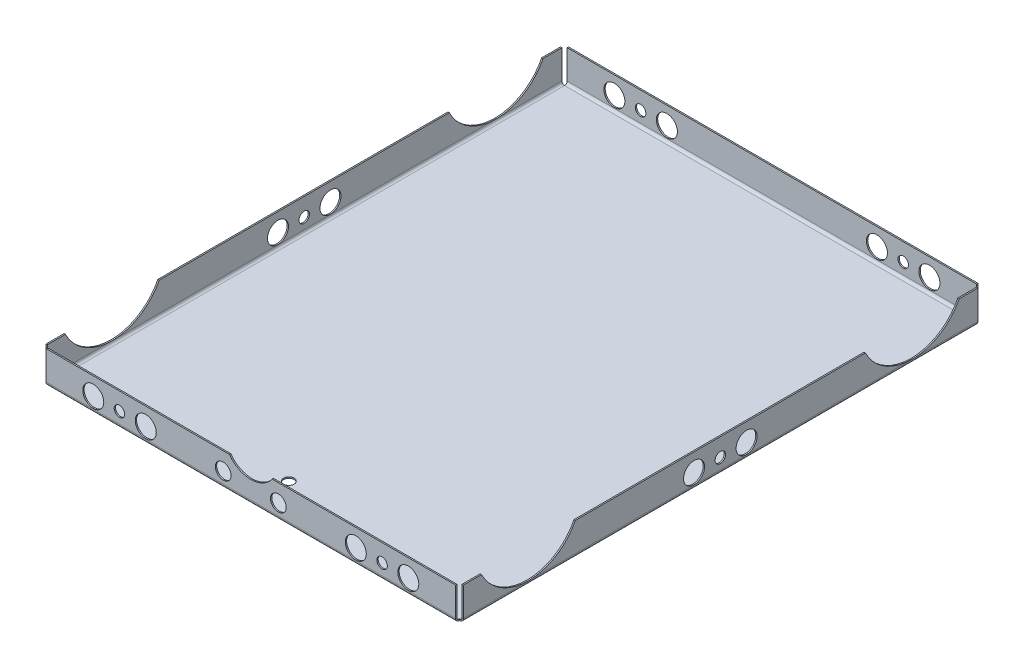
from build123d import *

# Parameters (mm, degrees)
SKETCH1_W           = 156
SKETCH1_H           = 196
BASE_FLANGE1_DEPTH  = 0.5
EDGE_FLANGE1_DEPTH  = 196
EDGE_FLANGE2_DEPTH  = 156
EDGE_FLANGE3_DEPTH  = 196
EDGE_FLANGE4_DEPTH  = 156
SKETCH14_R          = 3
CUT_EXTRUDE1_DEPTH  = 2
CUT_EXTRUDE2_START  = -0.5
CUT_EXTRUDE2_DEPTH  = 0.5
CUT_EXTRUDE7_START  = -0.5
CUT_EXTRUDE7_DEPTH  = 0.5
SKETCH18_R          = 2
CUT_EXTRUDE8_DEPTH  = 254.83311453
SKETCH19_R          = 2
CUT_EXTRUDE9_DEPTH  = 255.06938035
SKETCH20_R          = 4
CUT_EXTRUDE10_DEPTH = 5
CUT_EXTRUDE11_START = -5
SKETCH21_R          = 4
CUT_EXTRUDE11_DEPTH = 5
SKETCH22_R          = 4
CUT_EXTRUDE12_DEPTH = 5
CUT_EXTRUDE13_START = -5
SKETCH23_R          = 4
CUT_EXTRUDE13_DEPTH = 5
SKETCH24_R          = 10
CUT_EXTRUDE14_DEPTH = 1
SKETCH25_R          = 2
CUT_EXTRUDE15_DEPTH = 2


# Read off the part's stored shape, not the designer's step: Cut-Extrude2, Cut-Extrude7
# Sheet-metal steps are written as plain solids
with BuildPart() as part:
    # Sketch1 → Base-Flange1 (new body)
    with BuildSketch(Plane(origin=(0, 0, 0), x_dir=(1, 0, 0), z_dir=(0, 1, 0))):
        with Locations((78, -98)):
            Rectangle(SKETCH1_W, SKETCH1_H)
    extrude(amount=-BASE_FLANGE1_DEPTH)

    # Edge-Flange1 section (across the edge) → Edge-Flange1 (add)
    with BuildSketch(Plane(origin=(-1, 0, 0), x_dir=(1, 0, 0), z_dir=(0, 0, 1))):
        with BuildLine():
            Line((-0.5, 1), (-0.5, 12))
            Line((-0.5, 12), (0, 12))
            Line((0, 12), (0, 1))
            ThreePointArc((0, 1), (0.292893219, 0.292893219), (1, 0))
            Line((1, 0), (1, -0.5))
            ThreePointArc((1, -0.5), (-0.060660172, -0.060660172), (-0.5, 1))
        make_face()
    extrude(amount=EDGE_FLANGE1_DEPTH)

    # Edge-Flange2 section (across the edge) → Edge-Flange2 (add)
    with BuildSketch(Plane(origin=(0, 0, 197), x_dir=(0, 0, -1), z_dir=(1, 0, 0))):
        with BuildLine():
            Line((-0.5, 1), (-0.5, 12))
            Line((-0.5, 12), (0, 12))
            Line((0, 12), (0, 1))
            ThreePointArc((0, 1), (0.292893219, 0.292893219), (1, 0))
            Line((1, 0), (1, -0.5))
            ThreePointArc((1, -0.5), (-0.060660172, -0.060660172), (-0.5, 1))
        make_face()
    extrude(amount=EDGE_FLANGE2_DEPTH)

    # Edge-Flange3 section (across the edge) → Edge-Flange3 (add)
    with BuildSketch(Plane(origin=(157, 0, 196), x_dir=(-1, 0, 0), z_dir=(0, 0, -1))):
        with BuildLine():
            Line((-0.5, 1), (-0.5, 12))
            Line((-0.5, 12), (0, 12))
            Line((0, 12), (0, 1))
            ThreePointArc((0, 1), (0.292893219, 0.292893219), (1, 0))
            Line((1, 0), (1, -0.5))
            ThreePointArc((1, -0.5), (-0.060660172, -0.060660172), (-0.5, 1))
        make_face()
    extrude(amount=EDGE_FLANGE3_DEPTH)

    # Edge-Flange4 section (across the edge) → Edge-Flange4 (add)
    with BuildSketch(Plane(origin=(156, 0, -1), x_dir=(0, 0, 1), z_dir=(-1, 0, 0))):
        with BuildLine():
            Line((-0.5, 1), (-0.5, 12))
            Line((-0.5, 12), (0, 12))
            Line((0, 12), (0, 1))
            ThreePointArc((0, 1), (0.292893219, 0.292893219), (1, 0))
            Line((1, 0), (1, -0.5))
            ThreePointArc((1, -0.5), (-0.060660172, -0.060660172), (-0.5, 1))
        make_face()
    extrude(amount=EDGE_FLANGE4_DEPTH)

    # Sketch14 → Cut-Extrude1 (cut)
    with BuildSketch(Plane.XY.offset(197.5)):
        with Locations((88.5, 5.312571767)):
            Circle(SKETCH14_R)
        with Locations((67.5, 5.312571767)):
            Circle(SKETCH14_R)
    extrude(amount=-CUT_EXTRUDE1_DEPTH, mode=Mode.SUBTRACT)

    # Cut-Extrude2 outline → Cut-Extrude2 (cut)
    with BuildSketch(Plane.ZY.offset(1.5).offset(CUT_EXTRUDE2_START)):
        with BuildLine():
            ThreePointArc((7.181368129, 12), (14.44892966, 4.034634629), (24.795691895, 1))
            add(Edge.make_bspline(
                [(24.795691895, 1), (24.960369193, 1), (25.12504649, 1), (25.289723788, 1)],
                knots=[0, 0, 0, 0, 1, 1, 1, 1], degree=3))
            ThreePointArc((25.289723788, 1), (35.636486024, 4.034634629), (42.904047554, 12))
            Line((42.904047554, 12), (7.181368129, 12))
        make_face()
        with BuildLine():
            Line((189.110571099, 12), (153.389428901, 12))
            ThreePointArc((153.389428901, 12), (171.25, 1), (189.110571099, 12))
        make_face()
    extrude(amount=CUT_EXTRUDE2_DEPTH, mode=Mode.SUBTRACT)

    # Cut-Extrude7 outline → Cut-Extrude7 (cut)
    with BuildSketch(Plane(origin=(157.5, 0, 0), x_dir=(0, 0, -1), z_dir=(1, 0, 0)).offset(CUT_EXTRUDE7_START)):
        with BuildLine():
            ThreePointArc((-189.110571099, 12), (-171.25, 1), (-153.389428901, 12))
            Line((-153.389428901, 12), (-189.110571099, 12))
        make_face()
        with BuildLine():
            add(Edge.make_bspline(
                [(-24.795691895, 1), (-24.960369193, 1), (-25.12504649, 1), (-25.289723788, 1)],
                knots=[0, 0, 0, 0, 1, 1, 1, 1], degree=3))
            ThreePointArc((-24.795691895, 1), (-14.44892966, 4.034634629), (-7.181368129, 12))
            Line((-7.181368129, 12), (-42.904047554, 12))
            ThreePointArc((-42.904047554, 12), (-35.636486024, 4.034634629), (-25.289723788, 1))
        make_face()
    extrude(amount=CUT_EXTRUDE7_DEPTH, mode=Mode.SUBTRACT)

    # Sketch18 → Cut-Extrude8 (cut, through all)
    with BuildSketch(Plane(origin=(157.5, 0, 0), x_dir=(0, 0, -1), z_dir=(1, 0, 0))):
        with Locations(Location((-98.146856175, 5.118141575, 0), (0, 0, 90))):
            Circle(SKETCH18_R)
    extrude(amount=-CUT_EXTRUDE8_DEPTH, mode=Mode.SUBTRACT)

    # Sketch19 → Cut-Extrude9 (cut, through all)
    with BuildSketch(Plane.XY.offset(197.5)):
        with Locations((27.98454493, 5.280354993)):
            Circle(SKETCH19_R)
        with Locations(Location((128.01545507, 5.280354993, 0), (0, 0, 180))):
            Circle(SKETCH19_R)
    extrude(amount=-CUT_EXTRUDE9_DEPTH, mode=Mode.SUBTRACT)

    # Sketch20 → Cut-Extrude10 (cut)
    with BuildSketch(Plane(origin=(157.5, 0, 0), x_dir=(0, 0, -1), z_dir=(1, 0, 0))):
        with Locations(Location((-88.146856175, 5.118141575, 0), (0, 0, 90))):
            Circle(SKETCH20_R)
        with Locations(Location((-108.146856175, 5.118141575, 0), (0, 0, 90))):
            Circle(SKETCH20_R)
    extrude(amount=-CUT_EXTRUDE10_DEPTH, mode=Mode.SUBTRACT)

    # Sketch21 → Cut-Extrude11 (cut)
    with BuildSketch(Plane.ZY.offset(1.5).offset(CUT_EXTRUDE11_START)):
        with Locations(Location((88.146856175, 5.118141575, 0), (0, 0, 90))):
            Circle(SKETCH21_R)
        with Locations(Location((108.146856175, 5.118141575, 0), (0, 0, 90))):
            Circle(SKETCH21_R)
    extrude(amount=CUT_EXTRUDE11_DEPTH, mode=Mode.SUBTRACT)

    # Sketch22 → Cut-Extrude12 (cut)
    with BuildSketch(Plane.XY.offset(197.5)):
        with Locations((138, 5.25)):
            Circle(SKETCH22_R)
        with Locations((118, 5.25)):
            Circle(SKETCH22_R)
        with Locations((38, 5.25)):
            Circle(SKETCH22_R)
        with Locations((18, 5.25)):
            Circle(SKETCH22_R)
    extrude(amount=-CUT_EXTRUDE12_DEPTH, mode=Mode.SUBTRACT)

    # Sketch23 → Cut-Extrude13 (cut)
    with BuildSketch(Plane(origin=(0, 0, -1.5), x_dir=(-1, 0, 0), z_dir=(0, 0, -1)).offset(CUT_EXTRUDE13_START)):
        with Locations(Location((-18, 5.25, 0), (0, 0, 180))):
            Circle(SKETCH23_R)
        with Locations(Location((-38, 5.25, 0), (0, 0, 180))):
            Circle(SKETCH23_R)
        with Locations(Location((-118, 5.25, 0), (0, 0, 180))):
            Circle(SKETCH23_R)
        with Locations(Location((-138, 5.25, 0), (0, 0, 180))):
            Circle(SKETCH23_R)
    extrude(amount=CUT_EXTRUDE13_DEPTH, mode=Mode.SUBTRACT)

    # Sketch24 → Cut-Extrude14 (cut)
    with BuildSketch(Plane.XY.offset(197.5)):
        with Locations((78, 17.812571767)):
            Circle(SKETCH24_R)
    extrude(amount=-CUT_EXTRUDE14_DEPTH, mode=Mode.SUBTRACT)

    # Sketch25 → Cut-Extrude15 (cut)
    with BuildSketch(Plane.XZ.offset(0.5)):
        with Locations(Location((78, 182.993325715, 0), (0, 0, 270))):
            Circle(SKETCH25_R)
    extrude(amount=-CUT_EXTRUDE15_DEPTH, mode=Mode.SUBTRACT)


solid = part.part
